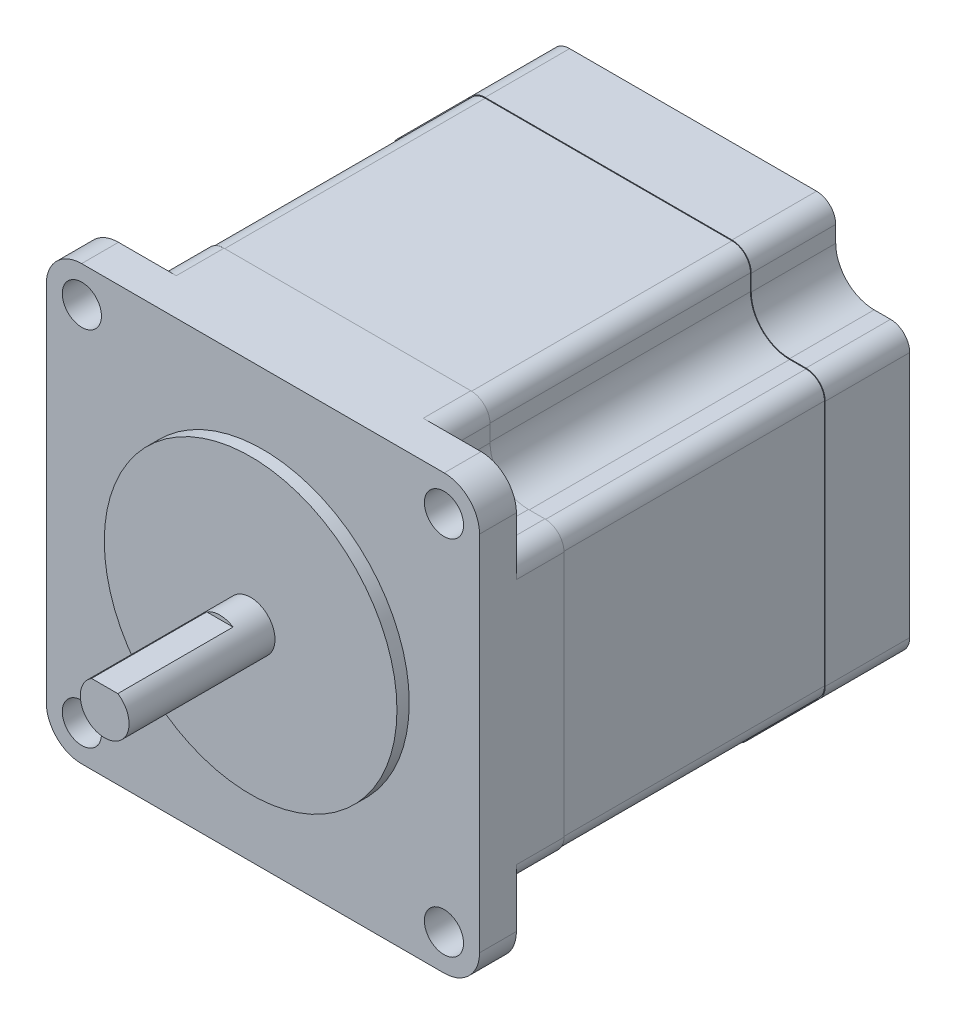
from build123d import *

# Parameters (mm, degrees)
SKETCH1_R           = 3.175
BOSS_EXTRUDE1_DEPTH = 20.6
SKETCH2_R           = 19.05
BOSS_EXTRUDE2_DEPTH = 1.6
BOSS_EXTRUDE3_DEPTH = 4.8
BOSS_EXTRUDE4_DEPTH = 51.2
SKETCH7_W           = 3.420526276
SKETCH7_H           = 1.112659396
CUT_EXTRUDE5_DEPTH  = 15
CUT_EXTRUDE6_REACH  = 70.749
SKETCH8_R           = 2.55
CUT_EXTRUDE7_DEPTH  = 17


with BuildPart() as part:
    # Sketch1 → Boss-Extrude1 (new body)
    with BuildSketch(Plane.XY):
        Circle(SKETCH1_R)
    extrude(amount=BOSS_EXTRUDE1_DEPTH)

    # Sketch2 → Boss-Extrude2 (add)
    with BuildSketch(Plane(origin=(0, 0, 0), x_dir=(-1, 0, 0), z_dir=(0, 0, -1))):
        Circle(SKETCH2_R)
    extrude(amount=-BOSS_EXTRUDE2_DEPTH)

    # Sketch3 → Boss-Extrude3 (add)
    with BuildSketch(Plane(origin=(0, 0, 0), x_dir=(-1, 0, 0), z_dir=(0, 0, -1))):
        with BuildLine():
            Line((23.6, -28.2), (-23.6, -28.2))
            ThreePointArc((-23.6, -28.2), (-26.852691193, -26.852691193), (-28.2, -23.6))
            Line((-28.2, -23.6), (-28.2, 23.6))
            ThreePointArc((-28.2, 23.6), (-26.852691193, 26.852691193), (-23.6, 28.2))
            Line((-23.6, 28.2), (23.6, 28.2))
            ThreePointArc((23.6, 28.2), (26.852691193, 26.852691193), (28.2, 23.6))
            Line((28.2, 23.6), (28.2, -23.6))
            ThreePointArc((28.2, -23.6), (26.852691193, -26.852691193), (23.6, -28.2))
        make_face()
    extrude(amount=BOSS_EXTRUDE3_DEPTH)

    # Sketch4 → Boss-Extrude4 (add)
    with BuildSketch(Plane(origin=(0, 0, -4.8), x_dir=(-1, 0, 0), z_dir=(0, 0, -1))):
        with BuildLine():
            Line((-18.57, 23.57), (-18.57, 25.7))
            ThreePointArc((-18.57, 25.7), (-17.837766953, 27.467766953), (-16.07, 28.2))
            Line((-16.07, 28.2), (16.07, 28.2))
            ThreePointArc((16.07, 28.2), (17.837766953, 27.467766953), (18.57, 25.7))
            Line((18.57, 25.7), (18.57, 23.57))
            ThreePointArc((18.57, 23.57), (20.034466094, 20.034466094), (23.57, 18.57))
            Line((23.57, 18.57), (25.7, 18.57))
            ThreePointArc((25.7, 18.57), (27.467766953, 17.837766953), (28.2, 16.07))
            Line((28.2, 16.07), (28.2, -16.07))
            ThreePointArc((28.2, -16.07), (27.467766953, -17.837766953), (25.7, -18.57))
            Line((25.7, -18.57), (23.57, -18.57))
            ThreePointArc((23.57, -18.57), (20.034466094, -20.034466094), (18.57, -23.57))
            Line((18.57, -23.57), (18.57, -25.7))
            ThreePointArc((18.57, -25.7), (17.837766953, -27.467766953), (16.07, -28.2))
            Line((16.07, -28.2), (-16.07, -28.2))
            ThreePointArc((-16.07, -28.2), (-17.837766953, -27.467766953), (-18.57, -25.7))
            Line((-18.57, -25.7), (-18.57, -23.57))
            ThreePointArc((-18.57, -23.57), (-20.034466094, -20.034466094), (-23.57, -18.57))
            Line((-23.57, -18.57), (-25.7, -18.57))
            ThreePointArc((-25.7, -18.57), (-27.467766953, -17.837766953), (-28.2, -16.07))
            Line((-28.2, -16.07), (-28.2, 16.07))
            ThreePointArc((-28.2, 16.07), (-27.467766953, 17.837766953), (-25.7, 18.57))
            Line((-25.7, 18.57), (-23.57, 18.57))
            ThreePointArc((-23.57, 18.57), (-20.034466094, 20.034466094), (-18.57, 23.57))
        make_face()
    extrude(amount=BOSS_EXTRUDE4_DEPTH)

    # Sketch7 → Cut-Extrude5 (cut)
    with BuildSketch(Plane.XY.offset(20.6)):
        with Locations((0, 3.231329698)):
            Rectangle(SKETCH7_W, SKETCH7_H)
    extrude(amount=-CUT_EXTRUDE5_DEPTH, mode=Mode.SUBTRACT)

    # Sketch8 → Cut-Extrude6 (cut, up to next)
    with BuildSketch(Plane.XY, mode=Mode.PRIVATE) as cut_extrude6_sk1:
        with Locations((-23.57, 23.57)):
            Circle(SKETCH8_R)
    cut_extrude6_tool1 = extrude(cut_extrude6_sk1.sketch, amount=-CUT_EXTRUDE6_REACH, mode=Mode.PRIVATE) & part.part
    # Sketch8 → Cut-Extrude6 (cut, up to next)
    with BuildSketch(Plane.XY, mode=Mode.PRIVATE) as cut_extrude6_sk2:
        with Locations((23.57, 23.57)):
            Circle(SKETCH8_R)
    cut_extrude6_tool2 = extrude(cut_extrude6_sk2.sketch, amount=-CUT_EXTRUDE6_REACH, mode=Mode.PRIVATE) & part.part
    # Sketch8 → Cut-Extrude6 (cut, up to next)
    with BuildSketch(Plane.XY, mode=Mode.PRIVATE) as cut_extrude6_sk3:
        with Locations((23.57, -23.57)):
            Circle(SKETCH8_R)
    cut_extrude6_tool3 = extrude(cut_extrude6_sk3.sketch, amount=-CUT_EXTRUDE6_REACH, mode=Mode.PRIVATE) & part.part
    # Sketch8 → Cut-Extrude6 (cut, up to next)
    with BuildSketch(Plane.XY, mode=Mode.PRIVATE) as cut_extrude6_sk4:
        with Locations((-23.57, -23.57)):
            Circle(SKETCH8_R)
    cut_extrude6_tool4 = extrude(cut_extrude6_sk4.sketch, amount=-CUT_EXTRUDE6_REACH, mode=Mode.PRIVATE) & part.part
    add(cut_extrude6_tool1.solids().sort_by_distance((-23.57, 23.57, 0))[0], mode=Mode.SUBTRACT)
    add(cut_extrude6_tool2.solids().sort_by_distance((23.57, 23.57, 0))[0], mode=Mode.SUBTRACT)
    add(cut_extrude6_tool3.solids().sort_by_distance((23.57, -23.57, 0))[0], mode=Mode.SUBTRACT)
    add(cut_extrude6_tool4.solids().sort_by_distance((-23.57, -23.57, 0))[0], mode=Mode.SUBTRACT)

    # Sketch9 → Cut-Extrude7 (cut, symmetric)
    with BuildSketch(Plane.XY.offset(-28)):
        with BuildLine():
            Line((18.57, 23.57), (18.57, 25.7))
            ThreePointArc((18.57, 25.7), (17.837766953, 27.467766953), (16.07, 28.2))
            Line((16.07, 28.2), (-16.07, 28.2))
            ThreePointArc((-16.07, 28.2), (-17.837766953, 27.467766953), (-18.57, 25.7))
            Line((-18.57, 25.7), (-18.57, 23.57))
            ThreePointArc((-18.57, 23.57), (-20.034466094, 20.034466094), (-23.57, 18.57))
            Line((-23.57, 18.57), (-25.7, 18.57))
            ThreePointArc((-25.7, 18.57), (-27.467766953, 17.837766953), (-28.2, 16.07))
            Line((-28.2, 16.07), (-28.2, -16.07))
            ThreePointArc((-28.2, -16.07), (-27.467766953, -17.837766953), (-25.7, -18.57))
            Line((-25.7, -18.57), (-23.57, -18.57))
            ThreePointArc((-23.57, -18.57), (-20.034466094, -20.034466094), (-18.57, -23.57))
            Line((-18.57, -23.57), (-18.57, -25.7))
            ThreePointArc((-18.57, -25.7), (-17.837766953, -27.467766953), (-16.07, -28.2))
            Line((-16.07, -28.2), (16.07, -28.2))
            ThreePointArc((16.07, -28.2), (17.837766953, -27.467766953), (18.57, -25.7))
            Line((18.57, -25.7), (18.57, -23.57))
            ThreePointArc((18.57, -23.57), (20.034466094, -20.034466094), (23.57, -18.57))
            Line((23.57, -18.57), (25.7, -18.57))
            ThreePointArc((25.7, -18.57), (27.467766953, -17.837766953), (28.2, -16.07))
            Line((28.2, -16.07), (28.2, 16.07))
            ThreePointArc((28.2, 16.07), (27.467766953, 17.837766953), (25.7, 18.57))
            Line((25.7, 18.57), (23.57, 18.57))
            ThreePointArc((23.57, 18.57), (20.034466094, 20.034466094), (18.57, 23.57))
        make_face()
        with BuildLine():
            Line((18.47, 23.57), (18.47, 25.7))
            ThreePointArc((18.47, 25.7), (17.767056275, 27.397056275), (16.07, 28.1))
            Line((16.07, 28.1), (-16.07, 28.1))
            ThreePointArc((-16.07, 28.1), (-17.767056275, 27.397056275), (-18.47, 25.7))
            Line((-18.47, 25.7), (-18.47, 23.57))
            ThreePointArc((-18.47, 23.57), (-19.963755416, 19.963755416), (-23.57, 18.47))
            Line((-23.57, 18.47), (-25.7, 18.47))
            ThreePointArc((-25.7, 18.47), (-27.397056275, 17.767056275), (-28.1, 16.07))
            Line((-28.1, 16.07), (-28.1, -16.07))
            ThreePointArc((-28.1, -16.07), (-27.397056275, -17.767056275), (-25.7, -18.47))
            Line((-25.7, -18.47), (-23.57, -18.47))
            ThreePointArc((-23.57, -18.47), (-19.963755416, -19.963755416), (-18.47, -23.57))
            Line((-18.47, -23.57), (-18.47, -25.7))
            ThreePointArc((-18.47, -25.7), (-17.767056275, -27.397056275), (-16.07, -28.1))
            Line((-16.07, -28.1), (16.07, -28.1))
            ThreePointArc((16.07, -28.1), (17.767056275, -27.397056275), (18.47, -25.7))
            Line((18.47, -25.7), (18.47, -23.57))
            ThreePointArc((18.47, -23.57), (19.963755416, -19.963755416), (23.57, -18.47))
            Line((23.57, -18.47), (25.7, -18.47))
            ThreePointArc((25.7, -18.47), (27.397056275, -17.767056275), (28.1, -16.07))
            Line((28.1, -16.07), (28.1, 16.07))
            ThreePointArc((28.1, 16.07), (27.397056275, 17.767056275), (25.7, 18.47))
            Line((25.7, 18.47), (23.57, 18.47))
            ThreePointArc((23.57, 18.47), (19.963755416, 19.963755416), (18.47, 23.57))
        make_face(mode=Mode.SUBTRACT)
    extrude(amount=CUT_EXTRUDE7_DEPTH, both=True, mode=Mode.SUBTRACT)


solid = part.part
